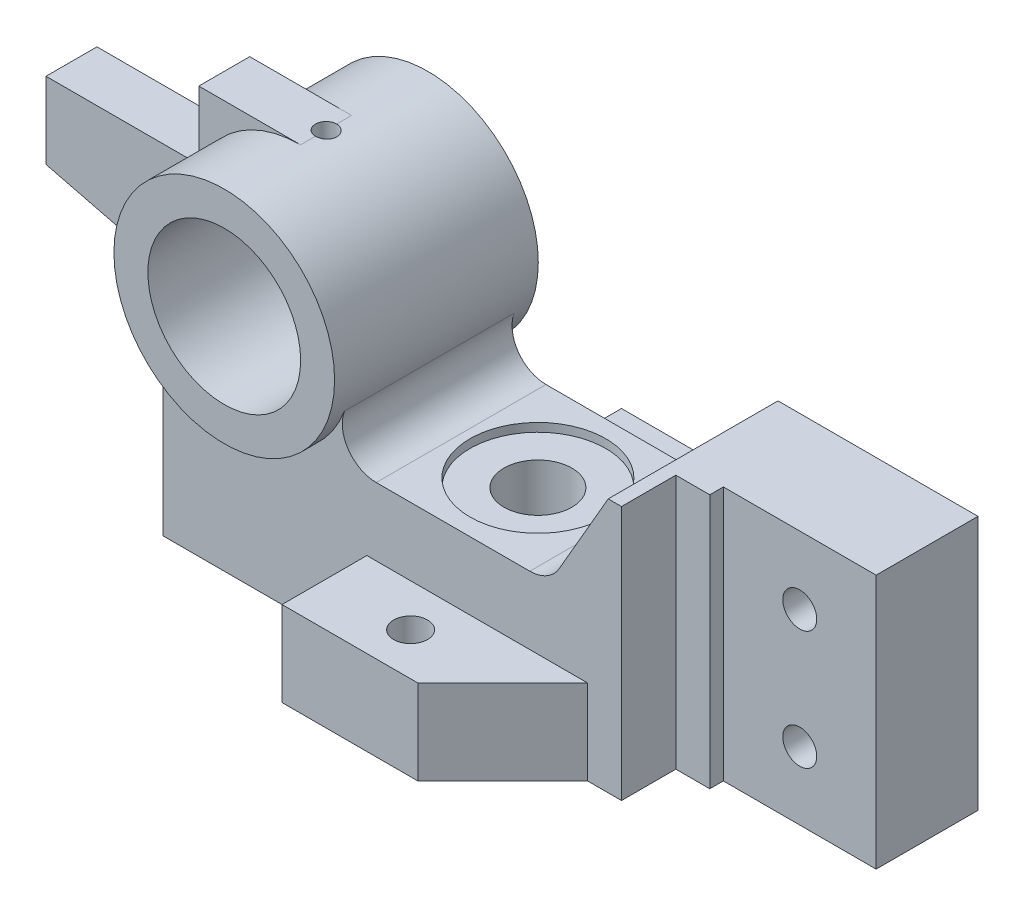
from build123d import *

# Parameters (mm, degrees)
SKETCH1_R               = 14.2875
BOSS_EXTRUDE1_DEPTH     = 4.7625
SKETCH1_5_R             = 14.2875
BOSS_EXTRUDE2_DEPTH     = 19.05
BOSS_EXTRUDE3_DEPTH     = 15.875
SKETCH1_7_W             = 41.275
SKETCH1_7_H             = 15.875
BOSS_EXTRUDE4_DEPTH     = 31.75
CUT_EXTRUDE1_DEPTH      = 117.564693796
CUT_EXTRUDE1_DEPTH_BACK = 117.564693796
SKETCH2_R               = 6.35
SKETCH2_5_R             = 12.7
SKETCH2_5_R_2           = 6.35
CUT_EXTRUDE4_DEPTH      = 1.5875
CUT_EXTRUDE5_DEPTH      = 122.144687625
CUT_EXTRUDE5_DEPTH_BACK = 122.144687625
SKETCH3_R               = 3.175
SKETCH4_R               = 3.175
CUT_EXTRUDE6_DEPTH      = 121.173461332
CUT_EXTRUDE7_REACH      = 130.416
CUT_EXTRUDE7_END_RADIUS = 14.2875
SKETCH5_R               = 1.984375


with BuildPart() as part:
    # Sketch1 → Boss-Extrude1 (new, symmetric)
    with BuildSketch(Plane.XY):
        with BuildLine():
            Line((-19.05, 20.6375), (-19.05, 7.9375))
            Line((-19.05, 7.9375), (-47.625, 7.9375))
            Line((-47.625, 7.9375), (-47.625, -6.35))
            Line((-47.625, -6.35), (-14.60235654, -14.583469742))
            Line((-14.60235654, -14.583469742), (-14.60235654, -44.45))
            Line((-14.60235654, -44.45), (106.04764346, -44.45))
            Line((106.04764346, -44.45), (106.04764346, 3.175))
            Line((106.04764346, 3.175), (68.639696837, 3.175))
            Line((68.639696837, 3.175), (59.474261314, -12.7))
            ThreePointArc((59.474261314, -12.7), (57.15, -15.024261314), (53.975, -15.875))
            Line((53.975, -15.875), (25.250733281, -15.875))
            ThreePointArc((25.250733281, -15.875), (20.027995944, -13.136857515), (19.309384274, -7.283823529))
            ThreePointArc((19.309384274, -7.283823529), (16.973896346, 11.738536922), (0, 20.6375))
            Line((0, 20.6375), (-19.05, 20.6375))
        make_face()
        Circle(SKETCH1_R, mode=Mode.SUBTRACT)
    extrude(amount=BOSS_EXTRUDE1_DEPTH, both=True)

    # Sketch1<5> → Boss-Extrude2 (add, symmetric)
    with BuildSketch(Plane.XY):
        with BuildLine():
            ThreePointArc((20.6375, 0), (14.592916197, 14.592916197), (0, 20.6375))
            ThreePointArc((0, 20.6375), (-11.4476253, 17.171437949), (-19.05, 7.9375))
            ThreePointArc((-19.05, 7.9375), (-20.24645141, -3.998451143), (-14.60235654, -14.583469742))
            ThreePointArc((-14.60235654, -14.583469742), (4.342837348, -20.175385251), (19.309384274, -7.283823529))
            ThreePointArc((19.309384274, -7.283823529), (20.302756269, -3.70195815), (20.6375, 0))
        make_face()
        Circle(SKETCH1_5_R, mode=Mode.SUBTRACT)
    extrude(amount=BOSS_EXTRUDE2_DEPTH, both=True)

    # Sketch1<6> → Boss-Extrude3 (add, symmetric)
    with BuildSketch(Plane.XY):
        with BuildLine():
            ThreePointArc((25.250733281, -15.875), (20.027995944, -13.136857515), (19.309384274, -7.283823529))
            ThreePointArc((19.309384274, -7.283823529), (4.342837348, -20.175385251), (-14.60235654, -14.583469742))
            Line((-14.60235654, -14.583469742), (-14.60235654, -44.45))
            Line((-14.60235654, -44.45), (106.04764346, -44.45))
            Line((106.04764346, -44.45), (106.04764346, 3.175))
            Line((106.04764346, 3.175), (68.639696837, 3.175))
            Line((68.639696837, 3.175), (59.474261314, -12.7))
            ThreePointArc((59.474261314, -12.7), (57.15, -15.024261314), (53.975, -15.875))
            Line((53.975, -15.875), (25.250733281, -15.875))
        make_face()
    extrude(amount=BOSS_EXTRUDE3_DEPTH, both=True)

    # Sketch1<7> → Boss-Extrude4 (add, symmetric)
    with BuildSketch(Plane.XY):
        with Locations((44.13514346, -36.5125)):
            Rectangle(SKETCH1_7_W, SKETCH1_7_H)
    extrude(amount=BOSS_EXTRUDE4_DEPTH, both=True)

    # Sketch2 → Cut-Extrude1 (cut, two sides: drawn at the far end of the back side and taken through both)
    with BuildSketch(Plane(origin=(0, -15.875, 0), x_dir=(1, 0, 0), z_dir=(0, 1, 0)).offset(-CUT_EXTRUDE1_DEPTH_BACK)):
        Polygon((64.77264346, -15.875), (48.89764346, -31.75), (64.77264346, -31.75), align=None)
        Polygon((64.77264346, 15.875), (64.77264346, 31.75), (48.89764346, 31.75), align=None)
        Polygon((106.04764346, -15.875), (106.04764346, -3.175), (77.47264346, -3.175), (77.47264346, -5.715), (71.12264346, -5.715), (71.12264346, -15.875), align=None)
        with Locations((39.612866641, 0)):
            Circle(SKETCH2_R)
    extrude(amount=CUT_EXTRUDE1_DEPTH + CUT_EXTRUDE1_DEPTH_BACK, mode=Mode.SUBTRACT)

    # Sketch2<5> → Cut-Extrude4 (cut)
    # profile 1 of 4: a face of its own
    with BuildSketch(Plane(origin=(0, -15.875, 0), x_dir=(1, 0, 0), z_dir=(0, 1, 0))):
        with Locations((39.612866641, 0)):
            Circle(SKETCH2_5_R)
        with Locations((39.612866641, 0)):
            Circle(SKETCH2_5_R_2, mode=Mode.SUBTRACT)
    # profile 2 of 4: a face of its own
    with BuildSketch(Plane(origin=(0, -15.875, 0), x_dir=(1, 0, 0), z_dir=(0, 1, 0))):
        Polygon((48.89764346, -31.75), (64.77264346, -15.875), (64.77264346, -31.75), align=None)
    # profile 3 of 4: a face of its own
    with BuildSketch(Plane(origin=(0, -15.875, 0), x_dir=(1, 0, 0), z_dir=(0, 1, 0))):
        Polygon((64.77264346, 31.75), (48.89764346, 31.75), (64.77264346, 15.875), align=None)
    # profile 4 of 4: a face of its own
    with BuildSketch(Plane(origin=(0, -15.875, 0), x_dir=(1, 0, 0), z_dir=(0, 1, 0))):
        Polygon((106.04764346, -3.175), (77.47264346, -3.175), (77.47264346, -5.715), (71.12264346, -5.715), (71.12264346, -15.875), (106.04764346, -15.875), align=None)
    extrude(amount=-CUT_EXTRUDE4_DEPTH, mode=Mode.SUBTRACT)

    # Sketch3 → Cut-Extrude5 (cut, two sides: drawn at the far end of the back side and taken through both)
    with BuildSketch(Plane(origin=(0, -28.575, 0), x_dir=(1, 0, 0), z_dir=(0, 1, 0)).offset(-CUT_EXTRUDE5_DEPTH_BACK)):
        with Locations((39.612866641, 23.8125)):
            Circle(SKETCH3_R)
        with Locations((39.612866641, -23.8125)):
            Circle(SKETCH3_R)
    extrude(amount=CUT_EXTRUDE5_DEPTH + CUT_EXTRUDE5_DEPTH_BACK, mode=Mode.SUBTRACT)

    # Sketch4 → Cut-Extrude6 (cut, through all)
    with BuildSketch(Plane.XY.offset(3.175)):
        with Locations((91.76014346, -9.525)):
            Circle(SKETCH4_R)
        with Locations((91.76014346, -31.75)):
            Circle(SKETCH4_R)
    extrude(amount=-CUT_EXTRUDE6_DEPTH, mode=Mode.SUBTRACT)

    # Cut-Extrude7: up to this cylinder (the profile starts outside it)
    cut_extrude7_end = Plane(origin=(0, 0, 0), z_dir=(0, 0, -1)) * Cylinder(CUT_EXTRUDE7_END_RADIUS, 290.407, mode=Mode.PRIVATE)
    # Sketch5 → Cut-Extrude7 (cut, up to the surface)
    with BuildSketch(Plane(origin=(0, 20.6375, 0), x_dir=(1, 0, 0), z_dir=(0, 1, 0)), mode=Mode.PRIVATE) as cut_extrude7_sk1:
        Circle(SKETCH5_R)
    cut_extrude7_tool1 = extrude(cut_extrude7_sk1.sketch, amount=-CUT_EXTRUDE7_REACH, mode=Mode.PRIVATE) - cut_extrude7_end
    add(cut_extrude7_tool1.solids().sort_by_distance((0, 20.6375, 0))[0], mode=Mode.SUBTRACT)


solid = part.part
